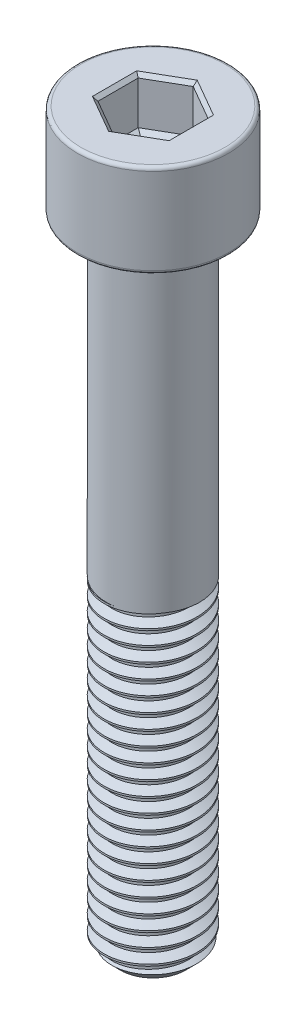
from build123d import *

# Parameters (mm, degrees)
SKETCH1_R           = 4
BOSS_EXTRUDE1_DEPTH = 28
THREAD1_PITCH       = 1.25
SKETCH2_R           = 4
BOSS_EXTRUDE2_DEPTH = 27
SKETCH5_R           = 6.5
BOSS_EXTRUDE3_DEPTH = 8
FILLET1_R           = 0.3
CUT_EXTRUDE1_DEPTH  = 4
CHAMFER1_SIZE       = 0.3
CUT_EXTRUDE2_DEPTH  = 0.4
CUT_EXTRUDE2_DRAFT  = -60


with BuildPart() as part:
    # Sketch1 → Boss-Extrude1 (new body)
    with BuildSketch(Plane(origin=(0, 0, 0), x_dir=(1, 0, 0), z_dir=(0, 1, 0))):
        with Locations(Location((0, 0, 0), (0, 0, 270))):
            Circle(SKETCH1_R)
    extrude(amount=BOSS_EXTRUDE1_DEPTH)

    # Thread1: the profile of Thread Profile1 profile screwed along a right-hand helix of 24 turns, 8 arcs to a turn; built about Z, then put on its axis
    thread1_z = Axis((0, 0, 0), (0, 0, 1))
    thread1_corners = [(4.0003, 0, -0.000173205), (4.0003, 0, 1.093923202), (3.323417656, 0, 0.703124998), (3.323417656, 0, 0.390624998)]
    with BuildLine(mode=Mode.PRIVATE) as thread1_profile:
        Line(thread1_corners[0], thread1_corners[1])
        Line(thread1_corners[1], thread1_corners[2])
        Line(thread1_corners[2], thread1_corners[3])
        Line(thread1_corners[3], thread1_corners[0])
    thread1_cap = Face(thread1_profile.wire())
    thread1_turn_angles = [0, 22.5, 45, 67.5, 90, 112.5, 135, 157.5, 180, 202.5, 225, 247.5, 270, 292.5, 315, 337.5, 360]
    thread1_turn_weights = [1, 0.9238795325112867, 1, 0.9238795325112867, 1, 0.9238795325112867, 1, 0.9238795325112867, 1, 0.9238795325112867, 1, 0.9238795325112867, 1, 0.9238795325112867, 1, 0.9238795325112867, 1]
    thread1_turn_rails = [Edge.make_bspline([Vector(p[0], p[1], 0).rotate(thread1_z, thread1_turn_angles[k]) / thread1_turn_weights[k] + Vector(0, 0, p[2] + THREAD1_PITCH * thread1_turn_angles[k] / 360) for k in range(17)], [0, 0, 0, 1, 1, 2, 2, 3, 3, 4, 4, 5, 5, 6, 6, 7, 7, 8, 8, 8], 2, thread1_turn_weights) for p in thread1_corners]
    thread1_turn_sides = [Face.make_surface_from_curves(thread1_turn_rails[p[0]], thread1_turn_rails[p[1]]) for p in [(0, 1), (1, 2), (2, 3), (3, 0)]]
    thread1 = Plane(origin=(0, 30, 0), x_dir=(-1, 0, 0), z_dir=(0, -1, 0)) * Solid(Shell([*[p.moved(Location((0, 0, THREAD1_PITCH * i))) for i in range(24) for p in thread1_turn_sides], thread1_cap, thread1_cap.rotate(thread1_z, 8640).moved(Location((0, 0, THREAD1_PITCH * 8640 / 360)))]))
    add(thread1, mode=Mode.SUBTRACT)

    # Sketch2 → Boss-Extrude2 (add)
    with BuildSketch(Plane(origin=(0, 28, 0), x_dir=(1, 0, 0), z_dir=(0, 1, 0))):
        with Locations(Location((0, 0, 0), (0, 0, 117.593571361))):
            Circle(SKETCH2_R)
    extrude(amount=BOSS_EXTRUDE2_DEPTH)

    # Sketch5 → Boss-Extrude3 (add)
    with BuildSketch(Plane(origin=(0, 55, 0), x_dir=(1, 0, 0), z_dir=(0, 1, 0))):
        with Locations(Location((0, 0, 0), (0, 0, 270))):
            Circle(SKETCH5_R)
    extrude(amount=BOSS_EXTRUDE3_DEPTH)

    # Sketch6 → Cut-Revolve1 (revolve, cut)
    with BuildSketch(Plane.XY, mode=Mode.PRIVATE) as cut_revolve1_sk:
        Polygon((4.01, 0), (4.01, 1.2), (2.81, 0), align=None)
    revolve(cut_revolve1_sk.sketch.rotate(Axis((0, 0, 0), (0, 1, 0)), 117.593571361), axis=Axis((0, 0, 0), (0, 1, 0)), mode=Mode.SUBTRACT)

    # Fillet1
    fillet1_edges = [part.edges().sort_by_distance(p)[0] for p in [
        (0, 55, -6.5),
        (0, 63, -6.5),
    ]]
    fillet(fillet1_edges, radius=FILLET1_R)

    # Sketch7 → Cut-Extrude1 (cut)
    with BuildSketch(Plane(origin=(0, 63, 0), x_dir=(1, 0, 0), z_dir=(0, 1, 0))):
        Polygon((0, 3.464101615), (-3, 1.732050808), (-3, -1.732050808), (0, -3.464101615), (3, -1.732050808), (3, 1.732050808), align=None)
    extrude(amount=-CUT_EXTRUDE1_DEPTH, mode=Mode.SUBTRACT)

    # Chamfer1
    chamfer1_edges = [part.edges().sort_by_distance(p)[0] for p in [
        (1.5, 63, -2.598076211),
        (-1.5, 63, -2.598076211),
        (-3, 63, 0),
        (-1.5, 63, 2.598076211),
        (1.5, 63, 2.598076211),
        (3, 63, 0),
    ]]
    chamfer(chamfer1_edges, length=CHAMFER1_SIZE)


with BuildPart() as cut_extrude2_tool:
    # Sketch8 → Cut-Extrude2 (with draft: the straight prism first)
    with BuildSketch(Plane(origin=(0, 59, 0), x_dir=(1, 0, 0), z_dir=(0, 1, 0))):
        Polygon((0, 3.464101615), (-3, 1.732050808), (-3, -1.732050808), (0, -3.464101615), (3, -1.732050808), (3, 1.732050808), align=None)
    extrude(amount=-CUT_EXTRUDE2_DEPTH)
    # Cut-Extrude2: the draft: its side faces are tilted about the plane it starts from
    cut_extrude2_sides = [cut_extrude2_tool.faces().sort_by_distance(p)[0] for p in [
        (-1.5, 58.8, -2.598076211),
        (-3, 58.8, 0),
        (-1.5, 58.8, 2.598076211),
        (1.5, 58.8, 2.598076211),
        (3, 58.8, 0),
        (1.5, 58.8, -2.598076211),
    ]]
    draft(cut_extrude2_sides, Plane(origin=(0, 59, 0), x_dir=(1, 0, 0), z_dir=(0, 1, 0)), CUT_EXTRUDE2_DRAFT)


with BuildPart() as part_1:
    add(part.part)

    # Cut-Extrude2: cut by cut_extrude2_tool
    add(cut_extrude2_tool.part, mode=Mode.SUBTRACT)


solid = part_1.part
